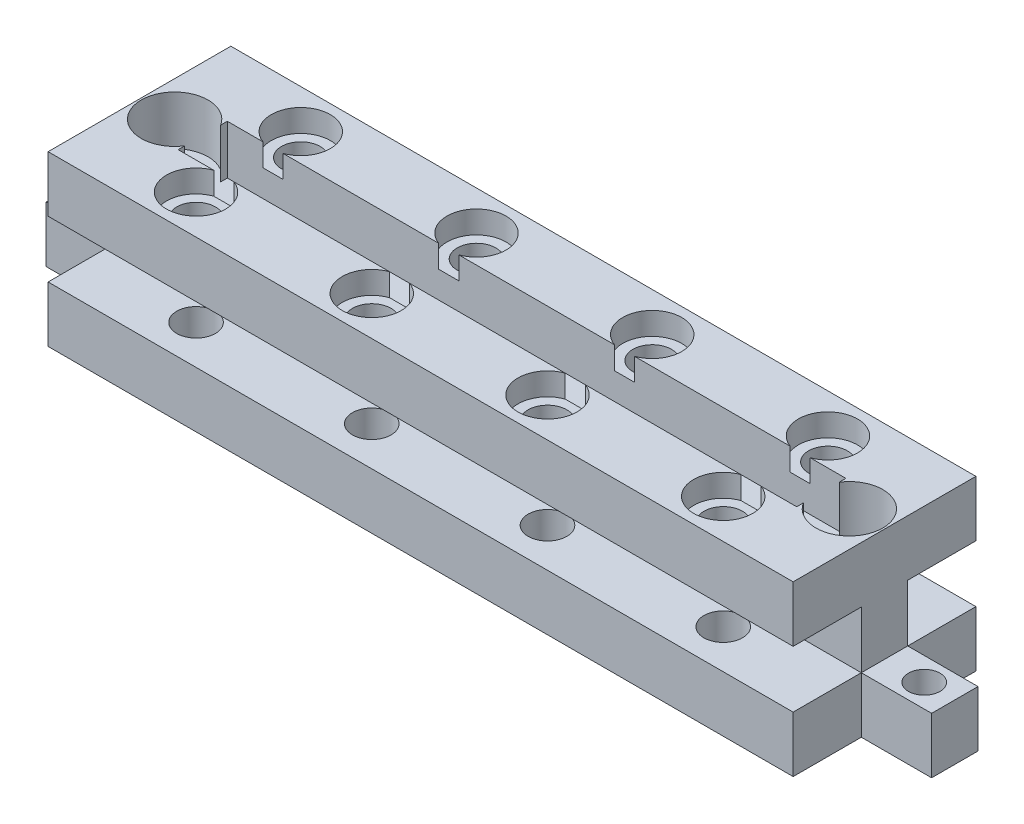
from build123d import *

# Parameters (mm, degrees)
SKETCH4_W                      = 106
SKETCH4_H                      = 24
BOSS_EXTRUDE2_DEPTH            = 13
CUT_EXTRUDE3_START             = -9.7
SKETCH25_W                     = 106
SKETCH25_H                     = 8.1
CUT_EXTRUDE3_DEPTH             = 110.207903902
M5_CLEARANCE_HOLE1_D           = 5.5
SKETCH39_R                     = 4.2
CUT_EXTRUDE5_DEPTH             = 3.2
MIRROR3_START                  = -40.65
MIRROR3_OUTLINE_W              = 106
MIRROR3_OUTLINE_H              = 13
MIRROR3_OUTLINE_R              = 2.75
MIRROR3_DEPTH                  = 7.948683024
MIRROR3_START_2                = -24.601316976
MIRROR3_2_OUTLINE_W            = 106
MIRROR3_2_OUTLINE_H            = 13
MIRROR3_2_OUTLINE_R            = 4.2
MIRROR3_2_DEPTH                = 7.951316976
MIRROR3_START_3                = -32.701316976
MIRROR3_3_OUTLINE_W            = 106
MIRROR3_3_OUTLINE_H            = 3.3
MIRROR3_3_DEPTH                = 12.851316976
MIRROR3_4_OUTLINE_R            = 2.75
MIRROR3_4_DEPTH                = 4.751316976
M4_CLEARANCE_HOLE2_D           = 4.5
SKETCH31_W                     = 88
SKETCH31_H                     = 7
CUT_EXTRUDE4_DEPTH             = 7
SKETCH32_W                     = 6.6
SKETCH32_H                     = 7.948683024
BOSS_EXTRUDE3_DEPTH            = 10
SKETCH37_W                     = 6.6
SKETCH37_H                     = 7.948683024
BOSS_EXTRUDE4_DEPTH            = 10
M4_CLEARANCE_HOLE1_D           = 4.5
M4_CLEARANCE_HOLE1_ON_FACE_2_D = 4.5
SKETCH42_R                     = 4.75
CUT_EXTRUDE9_DEPTH             = 7
SKETCH43_R                     = 4.75
CUT_EXTRUDE10_DEPTH            = 7


# Read off the part's stored shape, not the designer's step: Mirror3
with BuildPart() as part:
    # Sketch4 → Boss-Extrude2 (new body)
    with BuildSketch(Plane.XY):
        with Locations((-36.891047602, -28.65)):
            Rectangle(SKETCH4_W, SKETCH4_H)
    extrude(amount=-BOSS_EXTRUDE2_DEPTH)

    # Sketch25 → Cut-Extrude3 (cut)
    with BuildSketch(Plane.XY.offset(CUT_EXTRUDE3_START)):
        with Locations((-36.891047602, -28.651316976)):
            Rectangle(SKETCH25_W, SKETCH25_H)
    extrude(amount=CUT_EXTRUDE3_DEPTH, mode=Mode.SUBTRACT)

    # M5 Clearance Hole1 (through all)
    with Locations(Plane(origin=(-74.391047602, -16.65, -5.55), x_dir=(0, 0, 1), z_dir=(0, 1, 0))):
        with Locations((0, 0), (0, 25), (0, 75), (0, 50)):
            Hole(M5_CLEARANCE_HOLE1_D / 2)

    # Sketch39 → Cut-Extrude5 (cut)
    with BuildSketch(Plane(origin=(0, -16.65, 0), x_dir=(1, 0, 0), z_dir=(0, 1, 0))):
        with Locations(Location((0.608952398, 5.55, 0), (0, 0, 270))):
            Circle(SKETCH39_R)
        with Locations(Location((-24.391047602, 5.55, 0), (0, 0, 270))):
            Circle(SKETCH39_R)
        with Locations(Location((-49.391047602, 5.55, 0), (0, 0, 270))):
            Circle(SKETCH39_R)
        with Locations(Location((-74.391047602, 5.55, 0), (0, 0, 270))):
            Circle(SKETCH39_R)
    extrude(amount=-CUT_EXTRUDE5_DEPTH, mode=Mode.SUBTRACT)

    # Mirror3 outline → Mirror3 (add)
    with BuildSketch(Plane(origin=(0, 0, 0), x_dir=(1, 0, 0), z_dir=(0, 1, 0)).offset(MIRROR3_START)):
        with Locations((-36.891047602, 19.5)):
            Rectangle(MIRROR3_OUTLINE_W, MIRROR3_OUTLINE_H)
        with Locations((0.608952398, 20.45)):
            Circle(MIRROR3_OUTLINE_R, mode=Mode.SUBTRACT)
        with Locations((-24.391047602, 20.45)):
            Circle(MIRROR3_OUTLINE_R, mode=Mode.SUBTRACT)
        with Locations((-49.391047602, 20.45)):
            Circle(MIRROR3_OUTLINE_R, mode=Mode.SUBTRACT)
        with Locations((-74.391047602, 20.45)):
            Circle(MIRROR3_OUTLINE_R, mode=Mode.SUBTRACT)
    extrude(amount=MIRROR3_DEPTH)

    # Mirror3 2 outline → Mirror3 2 (add)
    with BuildSketch(Plane(origin=(0, 0, 0), x_dir=(1, 0, 0), z_dir=(0, 1, 0)).offset(MIRROR3_START_2)):
        with Locations((-36.891047602, 19.5)):
            Rectangle(MIRROR3_2_OUTLINE_W, MIRROR3_2_OUTLINE_H)
        with Locations((0.608952398, 20.45)):
            Circle(MIRROR3_2_OUTLINE_R, mode=Mode.SUBTRACT)
        with Locations((-24.391047602, 20.45)):
            Circle(MIRROR3_2_OUTLINE_R, mode=Mode.SUBTRACT)
        with Locations((-49.391047602, 20.45)):
            Circle(MIRROR3_2_OUTLINE_R, mode=Mode.SUBTRACT)
        with Locations((-74.391047602, 20.45)):
            Circle(MIRROR3_2_OUTLINE_R, mode=Mode.SUBTRACT)
    extrude(amount=MIRROR3_2_DEPTH)

    # Mirror3 3 outline → Mirror3 3 (add)
    with BuildSketch(Plane(origin=(0, 0, 0), x_dir=(1, 0, 0), z_dir=(0, 1, 0)).offset(MIRROR3_START_3)):
        with Locations((-36.891047602, 14.65)):
            Rectangle(MIRROR3_3_OUTLINE_W, MIRROR3_3_OUTLINE_H)
    extrude(amount=MIRROR3_3_DEPTH)

    # Mirror3 4 outline → Mirror3 4 (add)
    # profile 1 of 4: a face of its own
    with BuildSketch(Plane(origin=(0, 0, 0), x_dir=(1, 0, 0), z_dir=(0, 1, 0)).offset(MIRROR3_START_2)):
        with BuildLine():
            Line((-0.037190001, 16.3), (1.255094797, 16.3))
            ThreePointArc((1.255094797, 16.3), (0.608952398, 24.65), (-0.037190001, 16.3))
        make_face()
        with Locations((0.608952398, 20.45)):
            Circle(MIRROR3_4_OUTLINE_R, mode=Mode.SUBTRACT)
    # profile 2 of 4: a face of its own
    with BuildSketch(Plane(origin=(0, 0, 0), x_dir=(1, 0, 0), z_dir=(0, 1, 0)).offset(MIRROR3_START_2)):
        with BuildLine():
            ThreePointArc((-73.744905203, 16.3), (-74.391047602, 24.65), (-75.037190001, 16.3))
            Line((-75.037190001, 16.3), (-73.744905203, 16.3))
        make_face()
        with Locations((-74.391047602, 20.45)):
            Circle(MIRROR3_4_OUTLINE_R, mode=Mode.SUBTRACT)
    # profile 3 of 4: a face of its own
    with BuildSketch(Plane(origin=(0, 0, 0), x_dir=(1, 0, 0), z_dir=(0, 1, 0)).offset(MIRROR3_START_2)):
        with BuildLine():
            Line((-25.037190001, 16.3), (-23.744905203, 16.3))
            ThreePointArc((-23.744905203, 16.3), (-24.391047602, 24.65), (-25.037190001, 16.3))
        make_face()
        with Locations((-24.391047602, 20.45)):
            Circle(MIRROR3_4_OUTLINE_R, mode=Mode.SUBTRACT)
    # profile 4 of 4: a face of its own
    with BuildSketch(Plane(origin=(0, 0, 0), x_dir=(1, 0, 0), z_dir=(0, 1, 0)).offset(MIRROR3_START_2)):
        with BuildLine():
            ThreePointArc((-48.744905203, 16.3), (-49.391047602, 24.65), (-50.037190001, 16.3))
            Line((-50.037190001, 16.3), (-48.744905203, 16.3))
        make_face()
        with Locations((-49.391047602, 20.45)):
            Circle(MIRROR3_4_OUTLINE_R, mode=Mode.SUBTRACT)
    extrude(amount=MIRROR3_4_DEPTH)

    # M4 Clearance Hole2 (through all)
    with Locations(Plane(origin=(11.108952398, -40.65, -13), x_dir=(0, 0, -1), z_dir=(0, -1, 0))):
        with Locations((0, 0), (0, -96)):
            Hole(M4_CLEARANCE_HOLE2_D / 2)

    # Sketch31 → Cut-Extrude4 (cut)
    with BuildSketch(Plane(origin=(0, -16.65, 0), x_dir=(1, 0, 0), z_dir=(0, 1, 0))):
        with Locations((-36.891047602, 13)):
            Rectangle(SKETCH31_W, SKETCH31_H)
    extrude(amount=-CUT_EXTRUDE4_DEPTH, mode=Mode.SUBTRACT)

    # Sketch32 → Boss-Extrude3 (add)
    with BuildSketch(Plane.ZY.offset(89.891047602)):
        with Locations((-13, -36.675658488)):
            Rectangle(SKETCH32_W, SKETCH32_H)
    extrude(amount=BOSS_EXTRUDE3_DEPTH)

    # Sketch37 → Boss-Extrude4 (add)
    with BuildSketch(Plane(origin=(16.108952398, 0, 0), x_dir=(0, 0, -1), z_dir=(1, 0, 0))):
        with Locations((13, -36.675658488)):
            Rectangle(SKETCH37_W, SKETCH37_H)
    extrude(amount=BOSS_EXTRUDE4_DEPTH)

    # M4 Clearance Hole1 (through all)
    with Locations(Plane(origin=(-95.541407791, -40.65, -13), x_dir=(0, 0, -1), z_dir=(0, -1, 0))):
        with Locations((0, 0), (0, 117.300360189)):
            Hole(M4_CLEARANCE_HOLE1_D / 2)

    # M4 Clearance Hole1 on face 2 (through all)
    with Locations(Plane(origin=(38.237961727, 0, -11.003941324), x_dir=(0, 0, -1), z_dir=(0, -1, 0))):
        with Locations((0, 0)):
            Hole(M4_CLEARANCE_HOLE1_ON_FACE_2_D / 2)

    # Sketch42 → Cut-Extrude9 (cut)
    with BuildSketch(Plane(origin=(0, -16.65, 0), x_dir=(1, 0, 0), z_dir=(0, 1, 0))):
        with Locations((11.108952398, 13)):
            Circle(SKETCH42_R)
    extrude(amount=-CUT_EXTRUDE9_DEPTH, mode=Mode.SUBTRACT)

    # Sketch43 → Cut-Extrude10 (cut)
    with BuildSketch(Plane(origin=(0, -16.65, 0), x_dir=(1, 0, 0), z_dir=(0, 1, 0))):
        with Locations((-84.891047602, 13)):
            Circle(SKETCH43_R)
    extrude(amount=-CUT_EXTRUDE10_DEPTH, mode=Mode.SUBTRACT)


solid = part.part
